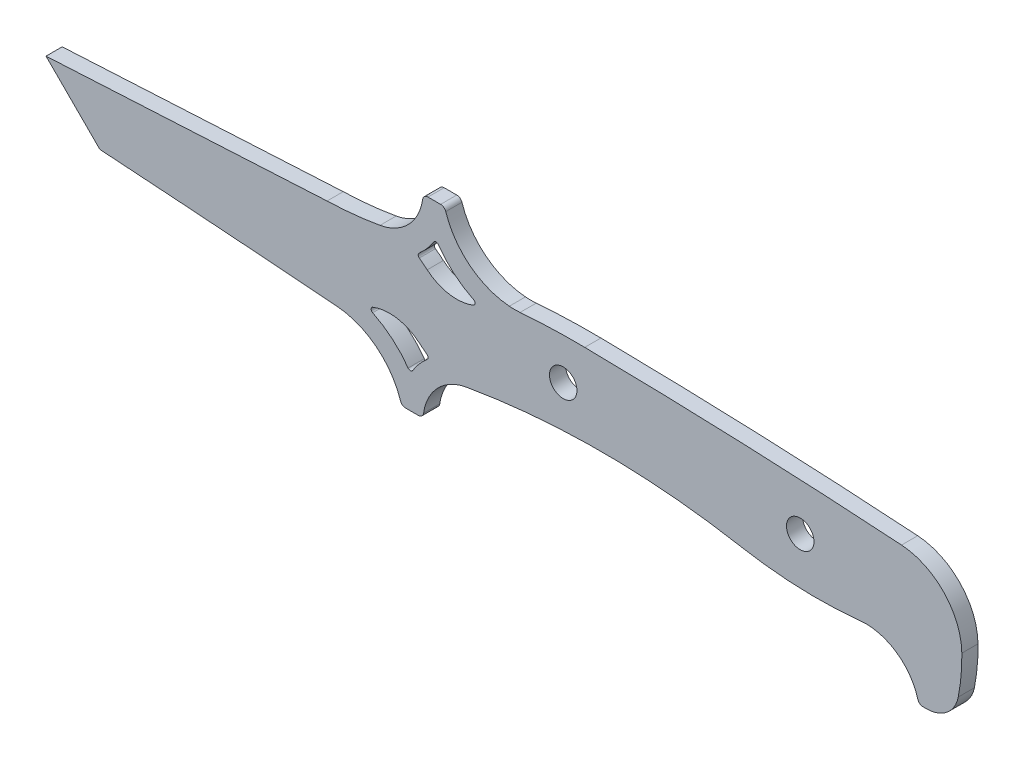
from build123d import *

# Parameters (mm, degrees)
EXTRUDE_1_DEPTH          = 1.5
CUT_EXTRUDE_1_DEPTH      = 103.666888528
CUT_EXTRUDE_1_DEPTH_BACK = 103.666888528
FILLET_2_R               = 0.5
CUT_EXTRUDE_2_DEPTH      = 103.666888649
CUT_EXTRUDE_2_DEPTH_BACK = 103.666888649
SKETCH_1_3_R             = 2.55
FILLET_3_R               = 1
FILLET_4_R               = 6


with BuildPart() as part:
    # 草图3 → 凸台-拉伸1 (new, symmetric)
    with BuildSketch(Plane.XY):
        with BuildLine():
            Line((-69, 0.053670233), (-17.82955426, 2.8))
            ThreePointArc((-17.82955426, 2.8), (-12.896888233, 3.124160122), (-8, 3.8))
            ThreePointArc((-8, 3.8), (-2.430316834, 6.904726075), (0, 12.8))
            Line((0, 12.8), (4, 12.8))
            ThreePointArc((4, 12.8), (8.408076037, 5.889691244), (16, 2.8))
            ThreePointArc((16, 2.8), (17, 2.76084796), (18, 2.8))
            ThreePointArc((18, 2.8), (23.995543283, 3.13181777), (30, 3.187869751))
            ThreePointArc((30, 3.187869751), (59.417196846, 2.392730865), (88.802581395, 0.810678063))
            ThreePointArc((88.802581395, 0.810678063), (96.698216606, -2.898372917), (99.995707153, -10.974552127))
            ThreePointArc((99.995707153, -10.974552127), (99.541657301, -17.176047698), (98, -23.2))
            Line((98, -23.2), (92, -23.2))
            ThreePointArc((92, -23.2), (88.137265129, -17.107894606), (81.180760268, -15.199620794))
            ThreePointArc((81.180760268, -15.199620794), (70.008857419, -15.549931577), (58.897172751, -14.339727161))
            ThreePointArc((58.897172751, -14.339727161), (33.454738164, -12.029006058), (8, -14.2))
            ThreePointArc((8, -14.2), (2.430316834, -17.304726075), (0, -23.2))
            Line((0, -23.2), (-4, -23.2))
            ThreePointArc((-4, -23.2), (-8.408076037, -16.289691244), (-16, -13.2))
            ThreePointArc((-16, -13.2), (-37.995468265, -11.53768865), (-60, -10))
            Line((-60, -10), (-70, 0))
            Line((-70, 0), (-69, 0.053670233))
        make_face()
    extrude(amount=EXTRUDE_1_DEPTH, both=True)

    # 草图1 → 切除-拉伸1 (cut, two sides: drawn at the far end of the back side and taken through both)
    with BuildSketch(Plane.XY.offset(-CUT_EXTRUDE_1_DEPTH_BACK)):
        with BuildLine():
            ThreePointArc((-0.761019142, -11.431762969), (-5.406379972, -9.480597645), (-10.341186305, -10.497509545))
            ThreePointArc((-10.341186305, -10.497509545), (-5.832437661, -13.229237439), (-2.341186305, -17.179214098))
            ThreePointArc((-2.341186305, -17.179214098), (-0.766744098, -14.886127905), (1.238980858, -12.95890712))
            ThreePointArc((1.238980858, -12.95890712), (0.221432916, -12.218316426), (-0.761019142, -11.431762969))
        make_face()
        with BuildLine():
            ThreePointArc((-1.238980858, 2.55890712), (-0.221432916, 1.818316426), (0.761019142, 1.031762969))
            ThreePointArc((0.761019142, 1.031762969), (5.406379972, -0.919402355), (10.341186305, 0.097509545))
            ThreePointArc((10.341186305, 0.097509545), (5.832437661, 2.829237439), (2.341186305, 6.779214098))
            ThreePointArc((2.341186305, 6.779214098), (0.766744098, 4.486127905), (-1.238980858, 2.55890712))
        make_face()
    extrude(amount=CUT_EXTRUDE_1_DEPTH + CUT_EXTRUDE_1_DEPTH_BACK, mode=Mode.SUBTRACT)

    # 圆角2
    fillet_2_edges = [part.edges().sort_by_distance(p)[0] for p in [
        (-10.341186305, -10.497509545, 0),
        (-2.341186305, -17.179214098, 0),
        (1.238980858, -12.95890712, 0),
        (10.341186305, 0.097509545, 0),
        (2.341186305, 6.779214098, 0),
        (-1.238980858, 2.55890712, 0),
    ]]
    fillet(fillet_2_edges, radius=FILLET_2_R)

    # 草图1<3> → 切除-拉伸2 (cut, two sides: drawn at the far end of the back side and taken through both)
    with BuildSketch(Plane.XY.offset(-CUT_EXTRUDE_2_DEPTH_BACK)):
        with Locations((70, -6.8)):
            Circle(SKETCH_1_3_R)
        with Locations((26, -4.5)):
            Circle(SKETCH_1_3_R)
    extrude(amount=CUT_EXTRUDE_2_DEPTH + CUT_EXTRUDE_2_DEPTH_BACK, mode=Mode.SUBTRACT)

    # 圆角3
    fillet_3_edges = [part.edges().sort_by_distance(p)[0] for p in [
        (0, -23.2, 0),
        (-4, -23.2, 0),
        (4, 12.8, 0),
        (0, 12.8, 0),
        (92, -23.2, 0),
    ]]
    fillet(fillet_3_edges, radius=FILLET_3_R)

    # 圆角4
    fillet_4_edges = [part.edges().sort_by_distance(p)[0] for p in [
        (98, -23.2, 0),
    ]]
    fillet(fillet_4_edges, radius=FILLET_4_R)


solid = part.part
